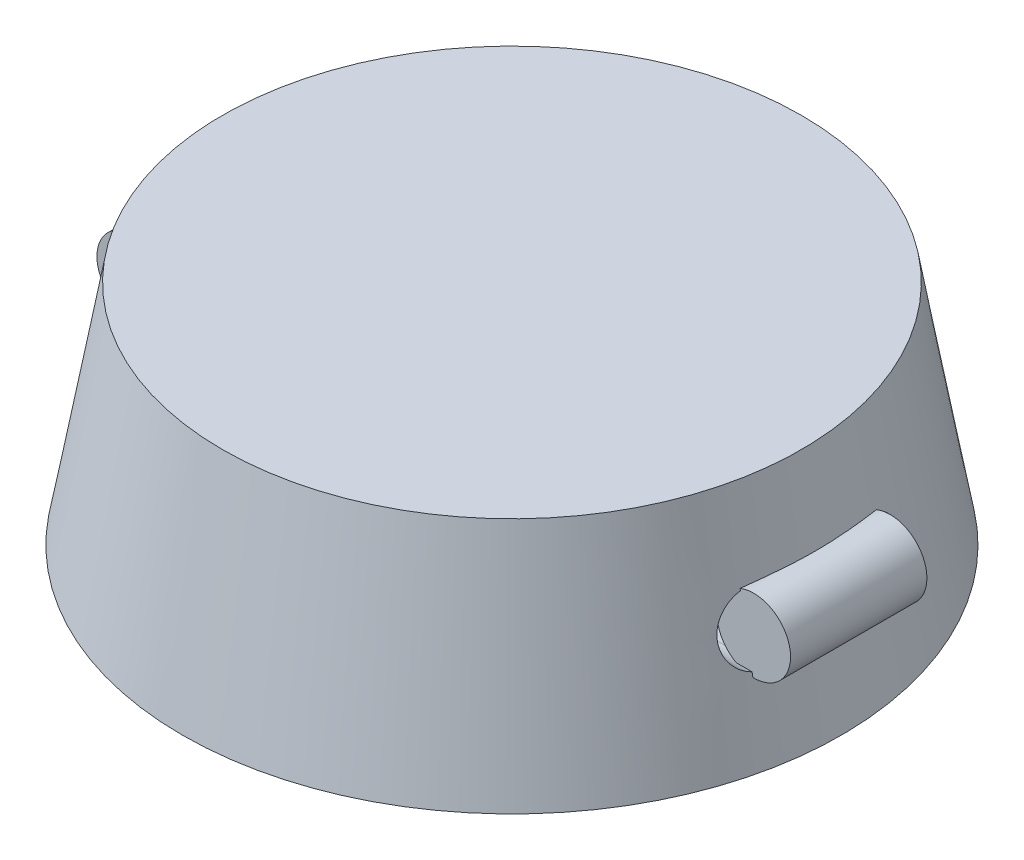
from build123d import *

# Parameters (mm, degrees)
SKETCH1_R               = 72.5
BOSS_EXTRUDE1_DEPTH     = 50
BOSS_EXTRUDE1_TAPER     = 10
CUT_EXTRUDE1_DEPTH      = 94
CUT_EXTRUDE1_DEPTH_BACK = 87
SKETCH3_R               = 8.075158441
BOSS_EXTRUDE5_DEPTH     = 15


with BuildPart() as part:
    # Sketch1 → Boss-Extrude1 (new body)
    with BuildSketch(Plane(origin=(0, 0, 0), x_dir=(1, 0, 0), z_dir=(0, 1, 0))):
        Circle(SKETCH1_R)
    extrude(amount=BOSS_EXTRUDE1_DEPTH, taper=BOSS_EXTRUDE1_TAPER)

    # Sketch2 → Cut-Extrude1 (cut, two sides: drawn at the far end of the back side and taken through both)
    with BuildSketch(Plane(origin=(0, 0, 0), x_dir=(0, 0, -1), z_dir=(1, 0, 0)).offset(-CUT_EXTRUDE1_DEPTH_BACK)):
        with BuildLine():
            Line((-12.527814818, 31.814648601), (12.472185182, 31.814648601))
            ThreePointArc((12.472185182, 31.814648601), (19.972185182, 24.314648601), (12.472185182, 16.814648601))
            Line((12.472185182, 16.814648601), (-12.527814818, 16.814648601))
            ThreePointArc((-12.527814818, 16.814648601), (-20.027814818, 24.314648601), (-12.527814818, 31.814648601))
        make_face()
    extrude(amount=CUT_EXTRUDE1_DEPTH + CUT_EXTRUDE1_DEPTH_BACK, mode=Mode.SUBTRACT)

    # Sketch3 → Boss-Extrude5 (add, symmetric)
    with BuildSketch(Plane.XY):
        with Locations((68.212671425, 24.314648601)):
            Circle(SKETCH3_R)
    boss_extrude5 = extrude(amount=BOSS_EXTRUDE5_DEPTH, both=True)

    # Mirror1: Boss-Extrude5 across plane
    add(boss_extrude5.mirror(Plane(origin=(0, 0, 0), x_dir=(0, 0, 1), z_dir=(1, 0, 0))))


solid = part.part
